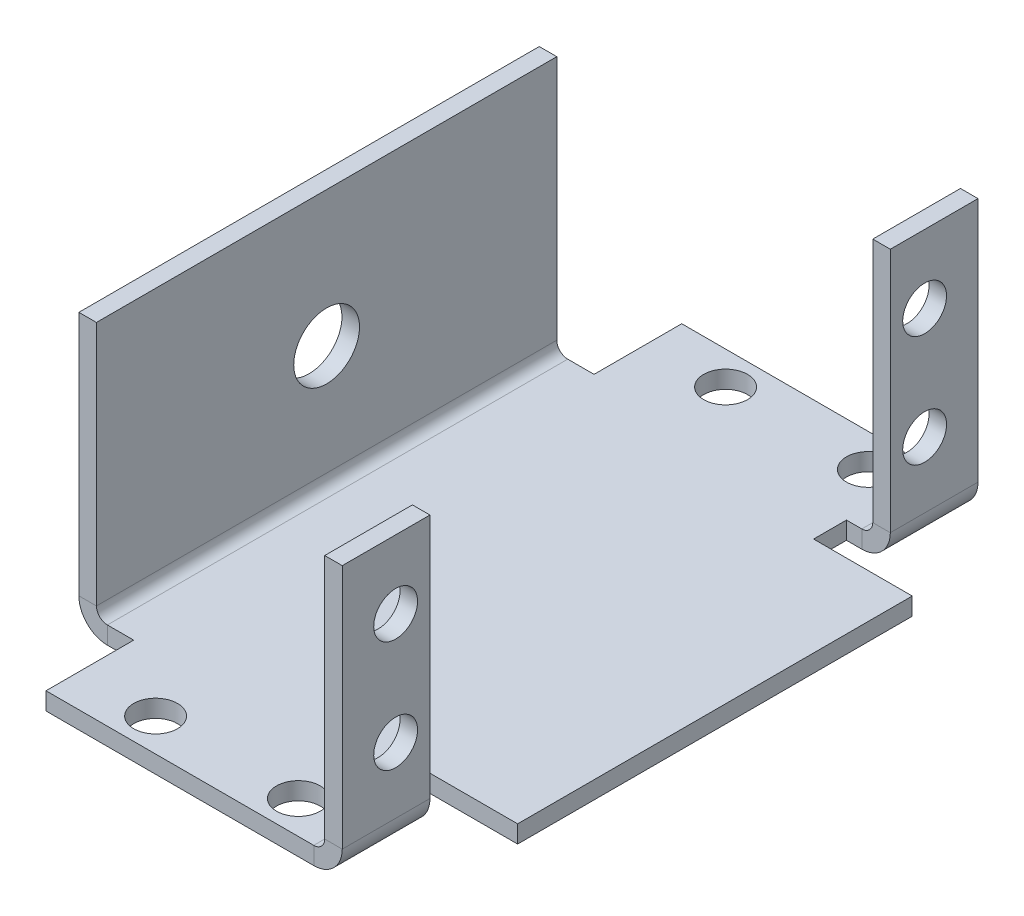
from build123d import *

# Parameters (mm, degrees)
SKETCH1_R                      = 2
BASE_FLANGE1_DEPTH             = 1.6
EDGE_FLANGE1_STRIP_W           = 8.4
EDGE_FLANGE1_STRIP_H           = 1.6
EDGE_FLANGE1_STRIP_CUT_DEPTH   = 8
EDGE_FLANGE1_STRIP_2_W         = 8.4
EDGE_FLANGE1_STRIP_2_H         = 1.6
EDGE_FLANGE1_STRIP_CUT_2_DEPTH = 8
EDGE_FLANGE1_STRIP_3_W         = 8.4
EDGE_FLANGE1_STRIP_3_H         = 1.6
EDGE_FLANGE1_STRIP_CUT_3_DEPTH = 42
EDGE_FLANGE1_DEPTH             = 8
EDGE_FLANGE1_BEND_DEPTH        = 8
EDGE_FLANGE1_BEND_2_DEPTH      = 42
CUT_EXTRUDE1_REACH             = 54.532
SKETCH14_R                     = 3
CUT_EXTRUDE2_REACH             = 51.136
SKETCH15_R                     = 2


# Sheet-metal steps are written as plain solids
with BuildPart() as part:
    # Sketch1 → Base-Flange1 (new body)
    with BuildSketch(Plane(origin=(0, 0, 0), x_dir=(1, 0, 0), z_dir=(0, 1, 0))):
        Polygon((-18.514, 21), (-13.514, 21), (-13.514, 29), (13.514, 29), (13.514, 21), (9.514, 21), (9.514, 18), (18.514, 18), (18.514, -18), (9.514, -18), (9.514, -21), (13.514, -21), (13.514, -29), (-13.514, -29), (-13.514, -21), (-18.514, -21), align=None)
        with Locations(Location((-6.514, 26, 0), (0, 0, 270))):
            Circle(SKETCH1_R, mode=Mode.SUBTRACT)
        with Locations(Location((6.514, 26, 0), (0, 0, 270))):
            Circle(SKETCH1_R, mode=Mode.SUBTRACT)
        with Locations(Location((6.514, -26, 0), (0, 0, 90))):
            Circle(SKETCH1_R, mode=Mode.SUBTRACT)
        with Locations(Location((-6.514, -26, 0), (0, 0, 90))):
            Circle(SKETCH1_R, mode=Mode.SUBTRACT)
    extrude(amount=-BASE_FLANGE1_DEPTH)

    # Edge-Flange1 strip (across the edge) → Edge-Flange1 strip cut (cut)
    with BuildSketch(Plane(origin=(13.514, 0, 29), x_dir=(-1, 0, 0), z_dir=(0, 0, -1))):
        with Locations((-1.6, -0.8)):
            Rectangle(EDGE_FLANGE1_STRIP_W, EDGE_FLANGE1_STRIP_H)
    extrude(amount=EDGE_FLANGE1_STRIP_CUT_DEPTH, mode=Mode.SUBTRACT)

    # Edge-Flange1 strip 2 (across the edge) → Edge-Flange1 strip cut 2 (cut)
    with BuildSketch(Plane(origin=(13.514, 0, -21), x_dir=(-1, 0, 0), z_dir=(0, 0, -1))):
        with Locations((-1.6, -0.8)):
            Rectangle(EDGE_FLANGE1_STRIP_2_W, EDGE_FLANGE1_STRIP_2_H)
    extrude(amount=EDGE_FLANGE1_STRIP_CUT_2_DEPTH, mode=Mode.SUBTRACT)

    # Edge-Flange1 strip 3 (across the edge) → Edge-Flange1 strip cut 3 (cut)
    with BuildSketch(Plane(origin=(-18.514, 0, -21), x_dir=(1, 0, 0), z_dir=(0, 0, 1))):
        with Locations((-1.6, -0.8)):
            Rectangle(EDGE_FLANGE1_STRIP_3_W, EDGE_FLANGE1_STRIP_3_H)
    extrude(amount=EDGE_FLANGE1_STRIP_CUT_3_DEPTH, mode=Mode.SUBTRACT)

    # Edge-Flange1 section (across the edge) → Edge-Flange1 (add)
    with BuildSketch(Plane(origin=(13.514, 0, 29), x_dir=(-1, 0, 0), z_dir=(0, 0, -1))):
        with BuildLine():
            Line((0, 1), (0, 23.4))
            Line((0, 23.4), (1.6, 23.4))
            Line((1.6, 23.4), (1.6, 1))
            ThreePointArc((1.6, 1), (1.892893219, 0.292893219), (2.6, 0))
            Line((2.6, 0), (2.6, -1.6))
            ThreePointArc((2.6, -1.6), (0.761522369, -0.838477631), (0, 1))
        make_face()
    extrude(amount=EDGE_FLANGE1_DEPTH)

    # Edge-Flange1 section 2 (across the edge) → Edge-Flange1 bend (add)
    with BuildSketch(Plane(origin=(13.514, 0, -21), x_dir=(-1, 0, 0), z_dir=(0, 0, -1))):
        with BuildLine():
            Line((0, 1), (0, 23.4))
            Line((0, 23.4), (1.6, 23.4))
            Line((1.6, 23.4), (1.6, 1))
            ThreePointArc((1.6, 1), (1.892893219, 0.292893219), (2.6, 0))
            Line((2.6, 0), (2.6, -1.6))
            ThreePointArc((2.6, -1.6), (0.761522369, -0.838477631), (0, 1))
        make_face()
    extrude(amount=EDGE_FLANGE1_BEND_DEPTH)

    # Edge-Flange1 section 3 (across the edge) → Edge-Flange1 bend 2 (add)
    with BuildSketch(Plane(origin=(-18.514, 0, -21), x_dir=(1, 0, 0), z_dir=(0, 0, 1))):
        with BuildLine():
            Line((0, 1), (0, 23.4))
            Line((0, 23.4), (1.6, 23.4))
            Line((1.6, 23.4), (1.6, 1))
            ThreePointArc((1.6, 1), (1.892893219, 0.292893219), (2.6, 0))
            Line((2.6, 0), (2.6, -1.6))
            ThreePointArc((2.6, -1.6), (0.761522369, -0.838477631), (0, 1))
        make_face()
    extrude(amount=EDGE_FLANGE1_BEND_2_DEPTH)

    # Sketch14 → Cut-Extrude1 (cut, up to next)
    with BuildSketch(Plane.ZY.offset(18.514), mode=Mode.PRIVATE) as cut_extrude1_sk1:
        with Locations(Location((0, 11.045309813, 0), (0, 0, 270))):
            Circle(SKETCH14_R)
    cut_extrude1_tool1 = extrude(cut_extrude1_sk1.sketch, amount=-CUT_EXTRUDE1_REACH, mode=Mode.PRIVATE) & part.part
    add(cut_extrude1_tool1.solids().sort_by_distance((-18.514, 11.04531, 0))[0], mode=Mode.SUBTRACT)

    # Sketch15 → Cut-Extrude2 (cut, up to next)
    with BuildSketch(Plane(origin=(13.514, 0, 0), x_dir=(0, 0, -1), z_dir=(1, 0, 0)), mode=Mode.PRIVATE) as cut_extrude2_sk1:
        with Locations(Location((-24.13, 7, 0), (0, 0, 90))):
            Circle(SKETCH15_R)
    cut_extrude2_tool1 = extrude(cut_extrude2_sk1.sketch, amount=-CUT_EXTRUDE2_REACH, mode=Mode.PRIVATE) & part.part
    # Sketch15 → Cut-Extrude2 (cut, up to next)
    with BuildSketch(Plane(origin=(13.514, 0, 0), x_dir=(0, 0, -1), z_dir=(1, 0, 0)), mode=Mode.PRIVATE) as cut_extrude2_sk2:
        with Locations(Location((-24.13, 17.16, 0), (0, 0, 90))):
            Circle(SKETCH15_R)
    cut_extrude2_tool2 = extrude(cut_extrude2_sk2.sketch, amount=-CUT_EXTRUDE2_REACH, mode=Mode.PRIVATE) & part.part
    # Sketch15 → Cut-Extrude2 (cut, up to next)
    with BuildSketch(Plane(origin=(13.514, 0, 0), x_dir=(0, 0, -1), z_dir=(1, 0, 0)), mode=Mode.PRIVATE) as cut_extrude2_sk3:
        with Locations(Location((24.13, 7, 0), (0, 0, 270))):
            Circle(SKETCH15_R)
    cut_extrude2_tool3 = extrude(cut_extrude2_sk3.sketch, amount=-CUT_EXTRUDE2_REACH, mode=Mode.PRIVATE) & part.part
    # Sketch15 → Cut-Extrude2 (cut, up to next)
    with BuildSketch(Plane(origin=(13.514, 0, 0), x_dir=(0, 0, -1), z_dir=(1, 0, 0)), mode=Mode.PRIVATE) as cut_extrude2_sk4:
        with Locations(Location((24.13, 17.16, 0), (0, 0, 270))):
            Circle(SKETCH15_R)
    cut_extrude2_tool4 = extrude(cut_extrude2_sk4.sketch, amount=-CUT_EXTRUDE2_REACH, mode=Mode.PRIVATE) & part.part
    add(cut_extrude2_tool1.solids().sort_by_distance((13.514, 7, 24.13))[0], mode=Mode.SUBTRACT)
    add(cut_extrude2_tool2.solids().sort_by_distance((13.514, 17.16, 24.13))[0], mode=Mode.SUBTRACT)
    add(cut_extrude2_tool3.solids().sort_by_distance((13.514, 7, -24.13))[0], mode=Mode.SUBTRACT)
    add(cut_extrude2_tool4.solids().sort_by_distance((13.514, 17.16, -24.13))[0], mode=Mode.SUBTRACT)


solid = part.part
